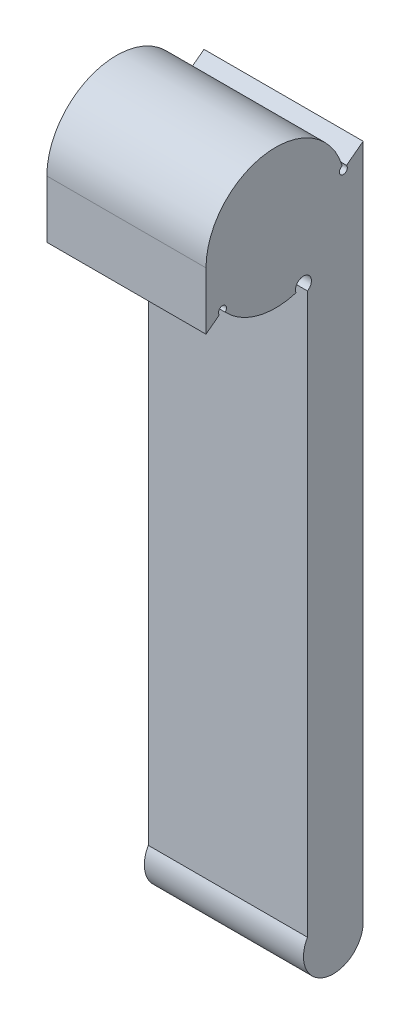
from build123d import *

# Parameters (mm, degrees)
BOSS_EXTRUDE1_DEPTH = 8
CUT_EXTRUDE1_DEPTH  = 38.332956939


with BuildPart() as part:
    # Sketch1 → Boss-Extrude1 (new body)
    with BuildSketch(Plane.YZ):
        with BuildLine():
            Line((21.778218983, -15.260770999), (22.403447361, -16.090477082))
            ThreePointArc((22.403447361, -16.090477082), (21.256795907, -17.969098146), (21.458282303, -20.160770999))
            Line((21.458282303, -20.160770999), (-7.771266811, -20.160770999))
            ThreePointArc((-7.771266811, -20.160770999), (-9.271266811, -21.660770999), (-7.771266811, -23.160770999))
            Line((-7.771266811, -23.160770999), (26.228733189, -23.160770999))
            Line((26.228733189, -23.160770999), (25.478499604, -22.165177406))
            ThreePointArc((25.478499604, -22.165177406), (28.142104739, -18.351761478), (24.66608529, -15.260770999))
            Line((24.66608529, -15.260770999), (21.778218983, -15.260770999))
        make_face()
    extrude(amount=BOSS_EXTRUDE1_DEPTH)

    # Sketch2 → Cut-Extrude1 (cut, through all)
    with BuildSketch(Plane(origin=(0, 0, 0), x_dir=(0, -1, 0), z_dir=(-1, 0, 0))):
        with BuildLine():
            Line((-22.254615534, -16.224077557), (-22.283084357, -15.93074998))
            ThreePointArc((-22.283084357, -15.93074998), (-22.602512003, -16.109797243), (-22.254615534, -16.224077557))
        make_face()
        with BuildLine():
            Line((-21.319492659, -20.160770999), (-21.319492659, -19.785621116))
            ThreePointArc((-21.319492659, -19.785621116), (-21.83451901, -20.296586831), (-21.111872142, -20.360770999))
            Line((-21.111872142, -20.360770999), (7.022935334, -20.360770999))
            ThreePointArc((7.022935334, -20.360770999), (7.383968477, -20.211633325), (7.771266811, -20.160770999))
            Line((7.771266811, -20.160770999), (-21.319492659, -20.160770999))
        make_face()
        with BuildLine():
            ThreePointArc((-25.598862609, -22.324904508), (-25.289362351, -22.100161258), (-25.671631303, -22.113214469))
            Line((-25.671631303, -22.113214469), (-25.598862609, -22.324904508))
        make_face()
    extrude(amount=-CUT_EXTRUDE1_DEPTH, mode=Mode.SUBTRACT)


solid = part.part
